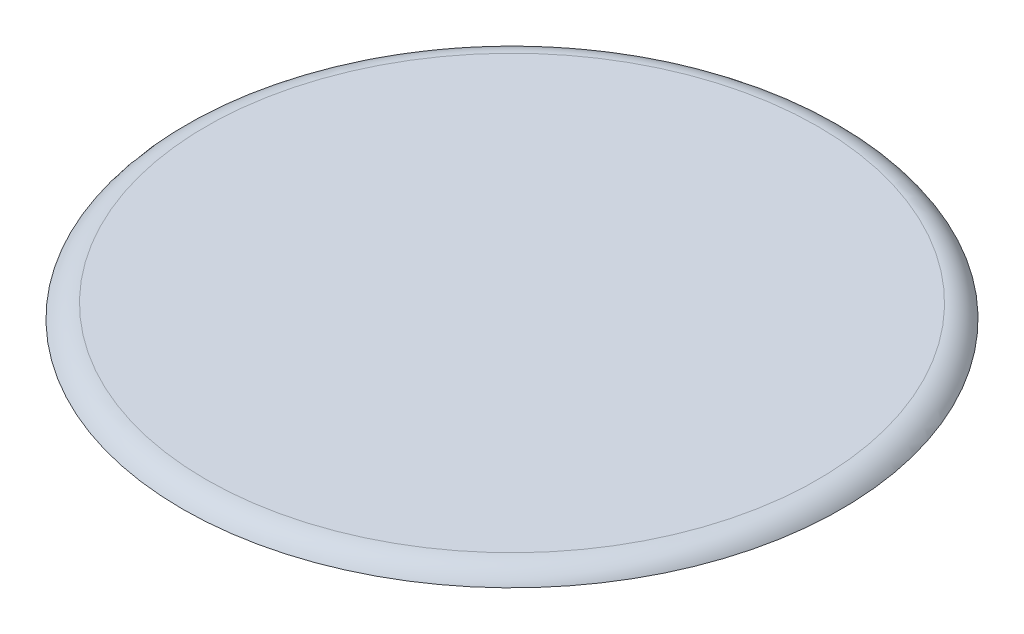
from build123d import *

# Parameters (mm, degrees)
SKETCH2_R           = 61.214
BOSS_EXTRUDE1_DEPTH = 2.54
FILLET1_R           = 5.08


with BuildPart() as part:
    # Sketch2 → Boss-Extrude1 (new body)
    with BuildSketch(Plane(origin=(0, 0, 0), x_dir=(1, 0, 0), z_dir=(0, 1, 0))):
        with Locations(Location((0, 0, 0), (0, 0, 270))):
            Circle(SKETCH2_R)
    extrude(amount=BOSS_EXTRUDE1_DEPTH)

    # Fillet1
    # the kernel refuses this fillet: 5.08 mm, written as the material it takes off along each edge
    with BuildSketch(Plane(origin=(0, 2.54, 0), x_dir=(0, 0, 1), z_dir=(-1, 0, 0))) as fillet1_piece_1:
        with BuildLine():
            CenterArc((56.814590949, -5.08), FILLET1_R, 30, 60)
            Line((56.814590949, 0), (56.814590949, 0.1016))
            Line((56.814590949, 0.1016), (61.214, 0.1016))
            Line((61.214, 0.1016), (61.3156, 0))
            ThreePointArc((61.3156, 0), (61.3156, -1.27), (61.301988181, -2.4892))
            Line((61.301988181, -2.4892), (61.214, -2.54))
        make_face()
    revolve(axis=Axis((0, 2.54, 0), (0, 1, 0)), mode=Mode.SUBTRACT)


solid = part.part
